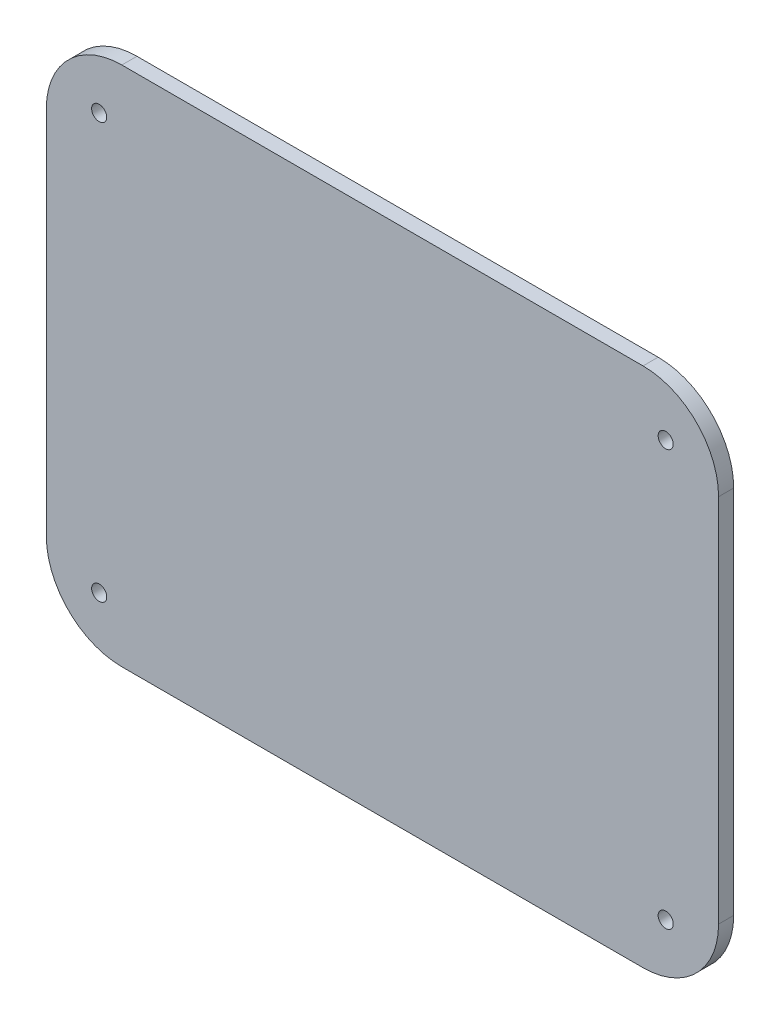
from build123d import *

# Parameters (mm, degrees)
SKETCH_1_R      = 1
EXTRUDE_1_DEPTH = 2


with BuildPart() as part:
    # 草图1 → 凸台-拉伸1 (new body)
    with BuildSketch(Plane.XY):
        with BuildLine():
            ThreePointArc((10, 0), (2.928932188, -2.928932188), (0, -10))
            Line((0, -10), (0, -59))
            ThreePointArc((0, -59), (2.928932188, -66.071067812), (10, -69))
            Line((10, -69), (79, -69))
            ThreePointArc((79, -69), (86.071067812, -66.071067812), (89, -59))
            Line((89, -59), (89, -10))
            ThreePointArc((89, -10), (86.071067812, -2.928932188), (79, 0))
            Line((79, 0), (10, 0))
        make_face()
        with Locations((7, -7)):
            Circle(SKETCH_1_R, mode=Mode.SUBTRACT)
        with Locations((82, -7)):
            Circle(SKETCH_1_R, mode=Mode.SUBTRACT)
        with Locations((7, -62)):
            Circle(SKETCH_1_R, mode=Mode.SUBTRACT)
        with Locations((82, -62)):
            Circle(SKETCH_1_R, mode=Mode.SUBTRACT)
    extrude(amount=-EXTRUDE_1_DEPTH)


solid = part.part
